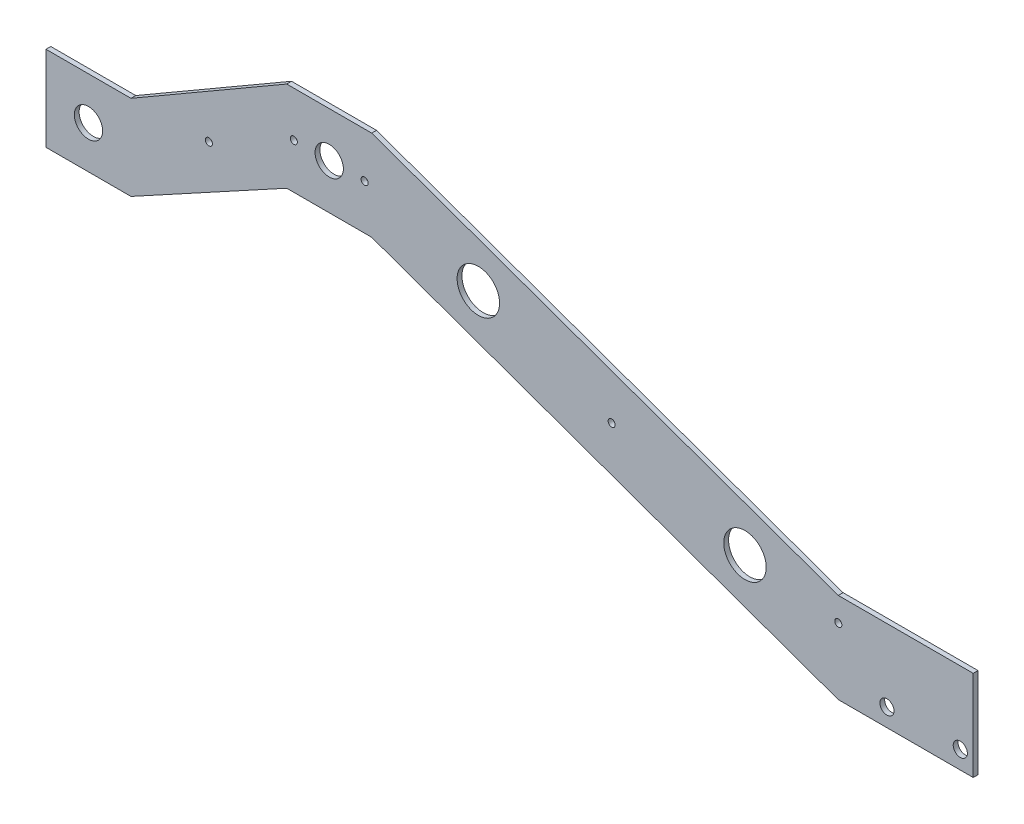
from build123d import *

# Parameters (mm, degrees)
SKETCH1_R          = 10
SKETCH1_R_2        = 2.5
SKETCH1_R_3        = 15
SKETCH1_R_4        = 5
BASE_FLANGE1_DEPTH = 3.4


# Sheet-metal steps are written as plain solids
with BuildPart() as part:
    # Sketch1 → Base-Flange1 (new body)
    with BuildSketch(Plane.XY):
        Polygon((0, 63.731432889), (0, 0), (-95.246303627, 0), (-424.746303627, 118), (-484.746303627, 118), (-594.746303627, 58), (-654.746303627, 58), (-654.746303627, 118), (-594.746303627, 118), (-484.746303627, 181.731432889), (-424.746303627, 181.731432889), (-95.246303627, 63.731432889), align=None)
        with Locations((-624.746303627, 88)):
            Circle(SKETCH1_R, mode=Mode.SUBTRACT)
        with Locations((-454.746303627, 149.865716445)):
            Circle(SKETCH1_R, mode=Mode.SUBTRACT)
        with Locations((-539.746303627, 118.932858222)):
            Circle(SKETCH1_R_2, mode=Mode.SUBTRACT)
        with Locations((-161.147850314, 55.466270342)):
            Circle(SKETCH1_R_3, mode=Mode.SUBTRACT)
        with Locations((-255.29291701, 89.181347338)):
            Circle(SKETCH1_R_2, mode=Mode.SUBTRACT)
        with Locations((-349.437983706, 122.896424333)):
            Circle(SKETCH1_R_3, mode=Mode.SUBTRACT)
        with Locations((-429.746303627, 149.865716445)):
            Circle(SKETCH1_R_2, mode=Mode.SUBTRACT)
        with Locations((-479.746303627, 149.865716445)):
            Circle(SKETCH1_R_2, mode=Mode.SUBTRACT)
        with Locations((-60.9, 12.7)):
            Circle(SKETCH1_R_4, mode=Mode.SUBTRACT)
        with Locations((-95.246303627, 46.865716445)):
            Circle(SKETCH1_R_2, mode=Mode.SUBTRACT)
        with Locations(Location((-9.1, 12.7, 0), (0, 0, 180))):
            Circle(SKETCH1_R_4, mode=Mode.SUBTRACT)
    extrude(amount=-BASE_FLANGE1_DEPTH)


solid = part.part
